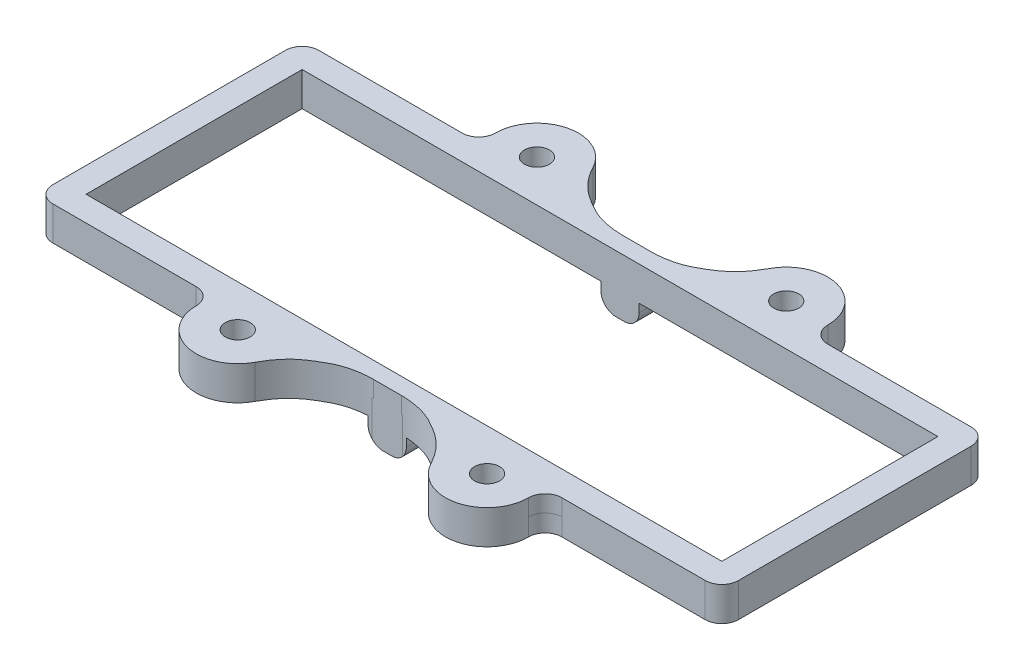
from build123d import *
from build123d.topology import SkipClean

# Parameters (mm, degrees)
SKETCH1_W           = 40
SKETCH1_H           = 7
SKETCH1_R           = 1.5
SKETCH1_W_2         = 82.5
SKETCH1_H_2         = 32
SKETCH1_W_3         = 76.5
SKETCH1_H_3         = 26
BOSS_EXTRUDE1_DEPTH = 2.085
SKETCH2_W           = 5
SKETCH2_H           = 10
BOSS_EXTRUDE2_DEPTH = 3
FILLET1_R           = 2
FILLET2_R           = 2
CUT_EXTRUDE1_DEPTH  = 65.136818612
SKETCH4_W           = 30
SKETCH4_H           = 6.817038716
CUT_EXTRUDE2_DEPTH  = 53.089568977
FILLET3_R           = 5
FILLET4_R           = 2
BOSS_EXTRUDE3_START = 2
SKETCH5_R           = 1.5
BOSS_EXTRUDE3_DEPTH = 2
FILLET5_START       = 2.085
FILLET5_DEPTH       = 2


with BuildPart() as part:
    # Sketch1 → Boss-Extrude1 (new body)
    # profile 1 of 3: a face of its own
    with BuildSketch(Plane(origin=(0, 0, 0), x_dir=(1, 0, 0), z_dir=(0, 1, 0))):
        with Locations((-3.342953498, -16.024946279)):
            Rectangle(SKETCH1_W, SKETCH1_H)
        with Locations(Location((-18.342953498, -14.524946279, 0), (0, 0, 270))):
            Circle(SKETCH1_R, mode=Mode.SUBTRACT)
        with Locations(Location((11.657046502, -14.524946279, 0), (0, 0, 270))):
            Circle(SKETCH1_R, mode=Mode.SUBTRACT)
    # profile 2 of 3: a face of its own
    with BuildSketch(Plane(origin=(0, 0, 0), x_dir=(1, 0, 0), z_dir=(0, 1, 0))):
        with Locations((-3.342953498, 3.475053721)):
            Rectangle(SKETCH1_W_2, SKETCH1_H_2)
        with Locations((-3.342953498, 3.475053721)):
            Rectangle(SKETCH1_W_3, SKETCH1_H_3, mode=Mode.SUBTRACT)
    # profile 3 of 3: a face of its own
    with BuildSketch(Plane(origin=(0, 0, 0), x_dir=(1, 0, 0), z_dir=(0, 1, 0))):
        with Locations((-3.342953498, 22.975053721)):
            Rectangle(SKETCH1_W, SKETCH1_H)
        with Locations(Location((-18.342953498, 21.475053721, 0), (0, 0, 270))):
            Circle(SKETCH1_R, mode=Mode.SUBTRACT)
        with Locations(Location((11.657046502, 21.475053721, 0), (0, 0, 270))):
            Circle(SKETCH1_R, mode=Mode.SUBTRACT)
    extrude(amount=BOSS_EXTRUDE1_DEPTH)

    # Sketch2 → Boss-Extrude2 (add)
    with BuildSketch(Plane.XZ):
        with Locations((-3.342953498, 14.524946279)):
            Rectangle(SKETCH2_W, SKETCH2_H)
        with Locations((-3.342953498, -21.475053721)):
            Rectangle(SKETCH2_W, SKETCH2_H)
    extrude(amount=BOSS_EXTRUDE2_DEPTH)

    # Fillet1
    fillet1_edges = [part.edges().sort_by_distance(p)[0] for p in [
        (-5.842953498, -3, 14.524946279),
        (-0.842953498, -3, 14.524946279),
        (-0.842953498, -3, -21.475053721),
        (-5.842953498, -3, -21.475053721),
    ]]
    fillet(fillet1_edges, radius=FILLET1_R)

    # Fillet2
    fillet2_edges = [part.edges().sort_by_distance(p)[0] for p in [
        (-44.592953498, 1.0425, 12.524946279),
        (-44.592953498, 1.0425, -19.475053721),
        (37.907046502, 1.0425, -19.475053721),
        (37.907046502, 1.0425, 12.524946279),
    ]]
    fillet(fillet2_edges, radius=FILLET2_R)

    # Sketch3 → Cut-Extrude1 (cut, through all)
    with BuildSketch(Plane(origin=(0, 0, -26.475053721), x_dir=(-1, 0, 0), z_dir=(0, 0, -1))):
        with BuildLine():
            Line((5.842953498, -1), (5.842953498, 0))
            Line((5.842953498, 0), (5.642953498, 0))
            Line((5.642953498, 0), (5.642953498, -1))
            ThreePointArc((5.642953498, -1), (5.115745704, -2.272792206), (3.842953498, -2.8))
            Line((3.842953498, -2.8), (2.842953498, -2.8))
            ThreePointArc((2.842953498, -2.8), (1.570161291, -2.272792206), (1.042953498, -1))
            Line((1.042953498, -1), (1.042953498, 0))
            Line((1.042953498, 0), (0.842953498, 0))
            Line((0.842953498, 0), (0.842953498, -1))
            ThreePointArc((0.842953498, -1), (1.428739935, -2.414213562), (2.842953498, -3))
            Line((2.842953498, -3), (3.842953498, -3))
            ThreePointArc((3.842953498, -3), (5.25716706, -2.414213562), (5.842953498, -1))
        make_face()
    extrude(amount=-CUT_EXTRUDE1_DEPTH, mode=Mode.SUBTRACT)

    # Sketch4 → Cut-Extrude2 (cut, through all)
    with BuildSketch(Plane(origin=(0, 2.085, 0), x_dir=(1, 0, 0), z_dir=(0, 1, 0))):
        with BuildLine():
            Line((-5.025587433, 18.475053721), (-3.342953498, 18.475053721))
            Line((-3.342953498, 18.475053721), (-1.660319563, 18.475053721))
            Line((-1.660319563, 18.475053721), (-1.5063675, 18.475053721))
            add(Edge.make_bspline(
                [(7.234880115, 23.808387054), (6.697838422, 22.80689338), (5.54618786, 21.222701251), (3.456402004, 19.887657692), (1.890908212, 19.048171258), (0.265447838, 18.611656881), (-0.841891354, 18.480685845), (-1.5063675, 18.475053721)],
                knots=[0, 0, 0, 0, 0.31493804, 0.524439854, 0.679221784, 0.802825172, 0.985869019, 0.985869019, 0.985869019, 0.985869019], degree=3))
            ThreePointArc((7.234880115, 23.808387054), (9.075057605, 25.756797914), (11.657046502, 26.475053721))
            Line((11.657046502, 26.475053721), (-18.342953498, 26.475053721))
            ThreePointArc((-18.342953498, 26.475053721), (-15.7609646, 25.756797914), (-13.92078711, 23.808387054))
            add(Edge.make_bspline(
                [(-13.92078711, 23.808387054), (-13.383745417, 22.80689338), (-12.232094855, 21.222701251), (-10.142308999, 19.887657692), (-8.576815207, 19.048171258), (-6.951354833, 18.611656881), (-5.844015641, 18.480685845), (-5.179539495, 18.475053721)],
                knots=[0, 0, 0, 0, 0.31493804, 0.524439854, 0.679221784, 0.802825172, 0.985869019, 0.985869019, 0.985869019, 0.985869019], degree=3))
            Line((-5.179539495, 18.475053721), (-5.025587433, 18.475053721))
        make_face()
        with Locations((-3.342953498, 29.883573079)):
            Rectangle(SKETCH4_W, SKETCH4_H)
        with BuildLine():
            ThreePointArc((-13.92078711, -16.858279612), (-15.7609646, -18.806690472), (-18.342953498, -19.524946279))
            Line((-18.342953498, -19.524946279), (11.657046502, -19.524946279))
            ThreePointArc((11.657046502, -19.524946279), (9.075057605, -18.806690472), (7.234880115, -16.858279612))
            add(Edge.make_bspline(
                [(7.234880115, -16.858279612), (6.697838422, -15.856785937), (5.54618786, -14.272593809), (3.456402004, -12.937550249), (1.890908212, -12.098063816), (0.265447838, -11.661549439), (-0.841891354, -11.530578403), (-1.5063675, -11.524946279)],
                knots=[0, 0, 0, 0, 0.31493804, 0.524439854, 0.679221784, 0.802825172, 0.985869019, 0.985869019, 0.985869019, 0.985869019], degree=3))
            Line((-1.5063675, -11.524946279), (-1.660319563, -11.524946279))
            Line((-1.660319563, -11.524946279), (-3.342953498, -11.524946279))
            Line((-3.342953498, -11.524946279), (-5.025587433, -11.524946279))
            Line((-5.025587433, -11.524946279), (-5.179539495, -11.524946279))
            add(Edge.make_bspline(
                [(-13.92078711, -16.858279612), (-13.383745417, -15.856785937), (-12.232094855, -14.272593809), (-10.142308999, -12.937550249), (-8.576815207, -12.098063816), (-6.951354833, -11.661549439), (-5.844015641, -11.530578403), (-5.179539495, -11.524946279)],
                knots=[0, 0, 0, 0, 0.31493804, 0.524439854, 0.679221784, 0.802825172, 0.985869019, 0.985869019, 0.985869019, 0.985869019], degree=3))
        make_face()
        with Locations((-3.342953498, -22.933465637)):
            Rectangle(SKETCH4_W, SKETCH4_H)
    extrude(amount=-CUT_EXTRUDE2_DEPTH, mode=Mode.SUBTRACT)

    # Fillet3
    fillet3_edges = [part.edges().sort_by_distance(p)[0] for p in [
        (16.657046502, 1.0425, -26.475053721),
        (-23.342953498, 1.0425, -26.475053721),
        (-23.342953498, 1.0425, 19.524946279),
        (16.657046502, 1.0425, 19.524946279),
    ]]
    fillet(fillet3_edges, radius=FILLET3_R - 0.0001)  # a hair under: the kernel refuses the full size

    # Fillet4
    fillet4_edges = [part.edges().sort_by_distance(p)[0] for p in [
        (-23.342953498, 1.0425, 12.524946279),
        (-23.342953498, 1.0425, -19.475053721),
        (16.657046502, 1.0425, -19.475053721),
        (16.657046502, 1.0425, 12.524946279),
    ]]
    fillet(fillet4_edges, radius=FILLET4_R)

    # Sketch5 → Boss-Extrude3 (add)
    # profile 1 of 26: a face of its own
    with SkipClean():  # the faces are left unmerged after this step: merging them gives an invalid solid
        with BuildSketch(Plane(origin=(0, 2.085, 0), x_dir=(1, 0, 0), z_dir=(0, 1, 0)).offset(BOSS_EXTRUDE3_START)):
            with BuildLine():
                ThreePointArc((-18.343003498, 26.475053721), (-21.878490939, 25.010584091), (-23.342953497, 21.475093721))
                ThreePointArc((-23.342953497, 21.475093721), (-23.237489148, 20.453525081), (-22.925529193, 19.475053721))
                Line((-22.925529193, 19.475053721), (-14.342953498, 19.475053721))
                Line((-14.342953498, 19.475053721), (-14.342953498, 24.475053721))
                ThreePointArc((-14.342953498, 24.475053721), (-16.106907881, 25.947200856), (-18.343003498, 26.475053721))
            make_face()
            with Locations((-18.342953498, 21.475053721)):
                Circle(SKETCH5_R, mode=Mode.SUBTRACT)
        # profile 2 of 26: a face of its own
        with BuildSketch(Plane(origin=(0, 2.085, 0), x_dir=(1, 0, 0), z_dir=(0, 1, 0)).offset(BOSS_EXTRUDE3_START)):
            with BuildLine():
                Line((-22.925529193, 19.475053721), (-23.342953498, 19.475053721))
                Line((-23.342953498, 19.475053721), (-23.342953498, 16.475053721))
                Line((-23.342953498, 16.475053721), (-18.342953499, 16.475053721))
                ThreePointArc((-18.342953499, 16.475053721), (-21.081566286, 17.291753589), (-22.925529193, 19.475053721))
            make_face()
        # profile 3 of 26: a face of its own
        with BuildSketch(Plane(origin=(0, 2.085, 0), x_dir=(1, 0, 0), z_dir=(0, 1, 0)).offset(BOSS_EXTRUDE3_START)):
            with BuildLine():
                Line((-23.342953498, 16.475053721), (-23.342953498, 19.475053721))
                Line((-23.342953498, 19.475053721), (-25.342953498, 19.475053721))
                Line((-25.342953498, 19.475053721), (-42.592953498, 19.475053721))
                ThreePointArc((-42.592953498, 19.475053721), (-44.00716706, 18.889267283), (-44.592953498, 17.475053721))
                Line((-44.592953498, 17.475053721), (-44.592953498, -10.524946279))
                ThreePointArc((-44.592953498, -10.524946279), (-44.00716706, -11.939159841), (-42.592953498, -12.524946279))
                Line((-42.592953498, -12.524946279), (-25.342953498, -12.524946279))
                Line((-25.342953498, -12.524946279), (-23.342953498, -12.524946279))
                Line((-23.342953498, -12.524946279), (-23.342953498, -9.524946279))
                Line((-23.342953498, -9.524946279), (-41.592953498, -9.524946279))
                Line((-41.592953498, -9.524946279), (-41.592953498, 16.475053721))
                Line((-41.592953498, 16.475053721), (-23.342953498, 16.475053721))
            make_face()
        # profile 4 of 26: a face of its own
        with BuildSketch(Plane(origin=(0, 2.085, 0), x_dir=(1, 0, 0), z_dir=(0, 1, 0)).offset(BOSS_EXTRUDE3_START)):
            with BuildLine():
                Line((-14.342953498, 19.475053721), (-22.925529193, 19.475053721))
                ThreePointArc((-22.925529193, 19.475053721), (-21.081566286, 17.291753589), (-18.342953499, 16.475053721))
                ThreePointArc((-18.342953499, 16.475053721), (-16.106885521, 17.002917766), (-14.342953498, 18.475053721))
                Line((-14.342953498, 18.475053721), (-14.342953498, 19.475053721))
            make_face()
        # profile 5 of 26: a face of its own
        with BuildSketch(Plane(origin=(0, 2.085, 0), x_dir=(1, 0, 0), z_dir=(0, 1, 0)).offset(BOSS_EXTRUDE3_START)):
            with BuildLine():
                ThreePointArc((-13.92078711, 23.808387054), (-14.118698205, 24.150061614), (-14.342953498, 24.475053721))
                Line((-14.342953498, 24.475053721), (-14.342953498, 19.475053721))
                Line((-14.342953498, 19.475053721), (-13.760377803, 19.475053721))
                ThreePointArc((-13.760377803, 19.475053721), (-13.448421933, 20.453505503), (-13.342953498, 21.475053721))
                ThreePointArc((-13.342953498, 21.475053721), (-13.489561285, 22.676962217), (-13.92078711, 23.808387054))
            make_face()
        # profile 6 of 26: a face of its own
        with BuildSketch(Plane(origin=(0, 2.085, 0), x_dir=(1, 0, 0), z_dir=(0, 1, 0)).offset(BOSS_EXTRUDE3_START)):
            with BuildLine():
                Line((-13.760377803, 19.475053721), (-14.342953498, 19.475053721))
                Line((-14.342953498, 19.475053721), (-14.342953498, 18.475053721))
                ThreePointArc((-14.342953498, 18.475053721), (-14.022635061, 18.958141206), (-13.760377803, 19.475053721))
            make_face()
        # profile 7 of 26: a face of its own
        with BuildSketch(Plane(origin=(0, 2.085, 0), x_dir=(1, 0, 0), z_dir=(0, 1, 0)).offset(BOSS_EXTRUDE3_START)):
            with BuildLine():
                ThreePointArc((-14.342953498, 18.475053721), (-16.106885521, 17.002917766), (-18.342953499, 16.475053721))
                Line((-18.342953499, 16.475053721), (11.657046523, 16.475053721))
                ThreePointArc((11.657046523, 16.475053721), (9.420978534, 17.002917762), (7.657046502, 18.475053721))
                Line((7.657046502, 18.475053721), (-1.5063675, 18.475053721))
                add(Edge.make_bspline(
                    [(-1.5063675, 18.475053721), (-1.557665042, 18.474618921), (-1.608983344, 18.47461649), (-1.660319563, 18.475053721)],
                    knots=[0.985869019, 0.985869019, 0.985869019, 0.985869019, 1, 1, 1, 1], degree=3))
                Line((-1.660319563, 18.475053721), (-3.342953498, 18.475053721))
                Line((-3.342953498, 18.475053721), (-5.025587433, 18.475053721))
                add(Edge.make_bspline(
                    [(-5.179539495, 18.475053721), (-5.128241953, 18.474618921), (-5.076923651, 18.47461649), (-5.025587433, 18.475053721)],
                    knots=[0.985869019, 0.985869019, 0.985869019, 0.985869019, 1, 1, 1, 1], degree=3))
                Line((-5.179539495, 18.475053721), (-14.342953498, 18.475053721))
            make_face()
        # profile 8 of 26: a face of its own
        with BuildSketch(Plane(origin=(0, 2.085, 0), x_dir=(1, 0, 0), z_dir=(0, 1, 0)).offset(BOSS_EXTRUDE3_START)):
            with BuildLine():
                add(Edge.make_bspline(
                    [(-13.92078711, 23.808387054), (-13.383745417, 22.80689338), (-12.232094855, 21.222701251), (-10.424029044, 20.067632367), (-9.557996846, 19.581589064), (-9.354549961, 19.475053721)],
                    knots=[0, 0, 0, 0, 0.31493804, 0.524439854, 0.587657191, 0.587657191, 0.587657191, 0.587657191], degree=3))
                ThreePointArc((-13.92078711, 23.808387054), (-13.489561285, 22.676962217), (-13.342953498, 21.475053721))
                ThreePointArc((-13.342953498, 21.475053721), (-13.448421933, 20.453505503), (-13.760377803, 19.475053721))
                Line((-13.760377803, 19.475053721), (-9.354549961, 19.475053721))
            make_face()
        # profile 9 of 26: a face of its own
        with BuildSketch(Plane(origin=(0, 2.085, 0), x_dir=(1, 0, 0), z_dir=(0, 1, 0)).offset(BOSS_EXTRUDE3_START)):
            with BuildLine():
                ThreePointArc((-13.760377803, 19.475053721), (-14.022635061, 18.958141206), (-14.342953498, 18.475053721))
                Line((-14.342953498, 18.475053721), (-5.179539495, 18.475053721))
                add(Edge.make_bspline(
                    [(-9.354549961, 19.475053721), (-9.059875559, 19.320746917), (-8.354121704, 18.98836733), (-6.951354833, 18.611656881), (-5.844015641, 18.480685845), (-5.179539495, 18.475053721)],
                    knots=[0.587657191, 0.587657191, 0.587657191, 0.587657191, 0.679221784, 0.802825172, 0.985869019, 0.985869019, 0.985869019, 0.985869019], degree=3))
                Line((-9.354549961, 19.475053721), (-13.760377803, 19.475053721))
            make_face()
        # profile 10 of 26: a face of its own
        with BuildSketch(Plane(origin=(0, 2.085, 0), x_dir=(1, 0, 0), z_dir=(0, 1, 0)).offset(BOSS_EXTRUDE3_START)):
            with BuildLine():
                ThreePointArc((16.239622197, 19.475053721), (14.395659298, 17.291753594), (11.657046523, 16.475053721))
                Line((11.657046523, 16.475053721), (16.657046502, 16.475053721))
                Line((16.657046502, 16.475053721), (16.657046502, 19.475053721))
                Line((16.657046502, 19.475053721), (16.239622197, 19.475053721))
            make_face()
        # profile 11 of 26: a face of its own
        with BuildSketch(Plane(origin=(0, 2.085, 0), x_dir=(1, 0, 0), z_dir=(0, 1, 0)).offset(BOSS_EXTRUDE3_START)):
            with BuildLine():
                ThreePointArc((7.657046502, 18.475053721), (9.420978534, 17.002917762), (11.657046523, 16.475053721))
                ThreePointArc((11.657046523, 16.475053721), (14.395659298, 17.291753594), (16.239622197, 19.475053721))
                Line((16.239622197, 19.475053721), (7.074470807, 19.475053721))
                ThreePointArc((7.074470807, 19.475053721), (7.336728066, 18.958141206), (7.657046502, 18.475053721))
            make_face()
        # profile 12 of 26: a face of its own
        with BuildSketch(Plane(origin=(0, 2.085, 0), x_dir=(1, 0, 0), z_dir=(0, 1, 0)).offset(BOSS_EXTRUDE3_START)):
            with BuildLine():
                Line((16.657046502, 19.475053721), (16.657046502, 16.475053721))
                Line((16.657046502, 16.475053721), (34.907046502, 16.475053721))
                Line((34.907046502, 16.475053721), (34.907046502, -9.524946279))
                Line((34.907046502, -9.524946279), (16.657046502, -9.524946279))
                Line((16.657046502, -9.524946279), (16.657046502, -12.524946279))
                Line((16.657046502, -12.524946279), (18.657046502, -12.524946279))
                Line((18.657046502, -12.524946279), (35.907046502, -12.524946279))
                ThreePointArc((35.907046502, -12.524946279), (37.321260065, -11.939159841), (37.907046502, -10.524946279))
                Line((37.907046502, -10.524946279), (37.907046502, 17.475053721))
                ThreePointArc((37.907046502, 17.475053721), (37.321260065, 18.889267283), (35.907046502, 19.475053721))
                Line((35.907046502, 19.475053721), (18.657046502, 19.475053721))
                Line((18.657046502, 19.475053721), (16.657046502, 19.475053721))
            make_face()
        # profile 13 of 26: a face of its own
        with BuildSketch(Plane(origin=(0, 2.085, 0), x_dir=(1, 0, 0), z_dir=(0, 1, 0)).offset(BOSS_EXTRUDE3_START)):
            with BuildLine():
                Line((-1.5063675, 18.475053721), (7.657046502, 18.475053721))
                ThreePointArc((7.657046502, 18.475053721), (7.336728066, 18.958141206), (7.074470807, 19.475053721))
                Line((7.074470807, 19.475053721), (2.668642966, 19.475053721))
                add(Edge.make_bspline(
                    [(2.668642966, 19.475053721), (2.373968563, 19.320746917), (1.668214709, 18.98836733), (0.265447838, 18.611656881), (-0.841891354, 18.480685845), (-1.5063675, 18.475053721)],
                    knots=[0.587657191, 0.587657191, 0.587657191, 0.587657191, 0.679221784, 0.802825172, 0.985869019, 0.985869019, 0.985869019, 0.985869019], degree=3))
            make_face()
        # profile 14 of 26: a face of its own
        with BuildSketch(Plane(origin=(0, 2.085, 0), x_dir=(1, 0, 0), z_dir=(0, 1, 0)).offset(BOSS_EXTRUDE3_START)):
            with BuildLine():
                Line((7.074470807, 19.475053721), (16.239622197, 19.475053721))
                ThreePointArc((16.239622197, 19.475053721), (16.551578067, 20.453505503), (16.657046502, 21.475053721))
                ThreePointArc((16.657046502, 21.475053721), (15.192598086, 25.010569949), (11.657096502, 26.475053721))
                ThreePointArc((11.657096502, 26.475053721), (9.075079014, 25.756810824), (7.234880115, 23.808387054))
                ThreePointArc((7.234880115, 23.808387054), (6.66046873, 21.660014702), (7.074470807, 19.475053721))
            make_face()
            with Locations((11.657046502, 21.475053721)):
                Circle(SKETCH5_R, mode=Mode.SUBTRACT)
        # profile 15 of 26: a face of its own
        with BuildSketch(Plane(origin=(0, 2.085, 0), x_dir=(1, 0, 0), z_dir=(0, 1, 0)).offset(BOSS_EXTRUDE3_START)):
            with BuildLine():
                Line((-18.342953493, -9.524946279), (-23.342953498, -9.524946279))
                Line((-23.342953498, -9.524946279), (-23.342953498, -12.524946279))
                Line((-23.342953498, -12.524946279), (-22.925529193, -12.524946279))
                ThreePointArc((-22.925529193, -12.524946279), (-21.081566283, -10.341646145), (-18.342953493, -9.524946279))
            make_face()
        # profile 16 of 26: a face of its own
        with BuildSketch(Plane(origin=(0, 2.085, 0), x_dir=(1, 0, 0), z_dir=(0, 1, 0)).offset(BOSS_EXTRUDE3_START)):
            with BuildLine():
                add(Edge.make_bspline(
                    [(7.234880115, 23.808387054), (6.697838422, 22.80689338), (5.54618786, 21.222701251), (3.738122049, 20.067632367), (2.872089851, 19.581589064), (2.668642966, 19.475053721)],
                    knots=[0, 0, 0, 0, 0.31493804, 0.524439854, 0.587657191, 0.587657191, 0.587657191, 0.587657191], degree=3))
                Line((2.668642966, 19.475053721), (7.074470807, 19.475053721))
                ThreePointArc((7.074470807, 19.475053721), (6.66046873, 21.660014702), (7.234880115, 23.808387054))
            make_face()
        # profile 17 of 26: a face of its own
        with BuildSketch(Plane(origin=(0, 2.085, 0), x_dir=(1, 0, 0), z_dir=(0, 1, 0)).offset(BOSS_EXTRUDE3_START)):
            with BuildLine():
                Line((11.657046502, -9.524946279), (-18.342953493, -9.524946279))
                ThreePointArc((-18.342953493, -9.524946279), (-16.106885518, -10.052810325), (-14.342953498, -11.524946279))
                Line((-14.342953498, -11.524946279), (-5.179539495, -11.524946279))
                add(Edge.make_bspline(
                    [(-5.179539495, -11.524946279), (-5.128241953, -11.524511479), (-5.076923651, -11.524509048), (-5.025587433, -11.524946279)],
                    knots=[0.985869019, 0.985869019, 0.985869019, 0.985869019, 1, 1, 1, 1], degree=3))
                Line((-5.025587433, -11.524946279), (-3.342953498, -11.524946279))
                Line((-3.342953498, -11.524946279), (-1.660319563, -11.524946279))
                add(Edge.make_bspline(
                    [(-1.5063675, -11.524946279), (-1.557665042, -11.524511479), (-1.608983344, -11.524509048), (-1.660319563, -11.524946279)],
                    knots=[0.985869019, 0.985869019, 0.985869019, 0.985869019, 1, 1, 1, 1], degree=3))
                Line((-1.5063675, -11.524946279), (7.657046502, -11.524946279))
                ThreePointArc((7.657046502, -11.524946279), (9.420978525, -10.052810324), (11.657046502, -9.524946279))
            make_face()
        # profile 18 of 26: a face of its own
        with BuildSketch(Plane(origin=(0, 2.085, 0), x_dir=(1, 0, 0), z_dir=(0, 1, 0)).offset(BOSS_EXTRUDE3_START)):
            with BuildLine():
                ThreePointArc((-14.342953498, -11.524946279), (-16.106885518, -10.052810325), (-18.342953493, -9.524946279))
                ThreePointArc((-18.342953493, -9.524946279), (-21.081566283, -10.341646145), (-22.925529193, -12.524946279))
                Line((-22.925529193, -12.524946279), (-13.760377803, -12.524946279))
                ThreePointArc((-13.760377803, -12.524946279), (-14.022635061, -12.008033764), (-14.342953498, -11.524946279))
            make_face()
        # profile 19 of 26: a face of its own
        with BuildSketch(Plane(origin=(0, 2.085, 0), x_dir=(1, 0, 0), z_dir=(0, 1, 0)).offset(BOSS_EXTRUDE3_START)):
            with BuildLine():
                Line((16.657046502, -9.524946279), (11.657046502, -9.524946279))
                ThreePointArc((11.657046502, -9.524946279), (14.39565929, -10.341646146), (16.239622197, -12.524946279))
                Line((16.239622197, -12.524946279), (16.657046502, -12.524946279))
                Line((16.657046502, -12.524946279), (16.657046502, -9.524946279))
            make_face()
        # profile 20 of 26: a face of its own
        with BuildSketch(Plane(origin=(0, 2.085, 0), x_dir=(1, 0, 0), z_dir=(0, 1, 0)).offset(BOSS_EXTRUDE3_START)):
            with BuildLine():
                ThreePointArc((16.239622197, -12.524946279), (14.39565929, -10.341646146), (11.657046502, -9.524946279))
                ThreePointArc((11.657046502, -9.524946279), (9.420978525, -10.052810324), (7.657046502, -11.524946279))
                ThreePointArc((7.657046502, -11.524946279), (7.336728066, -12.008033764), (7.074470807, -12.524946279))
                Line((7.074470807, -12.524946279), (16.239622197, -12.524946279))
            make_face()
        # profile 21 of 26: a face of its own
        with BuildSketch(Plane(origin=(0, 2.085, 0), x_dir=(1, 0, 0), z_dir=(0, 1, 0)).offset(BOSS_EXTRUDE3_START)):
            with BuildLine():
                Line((-5.179539495, -11.524946279), (-14.342953498, -11.524946279))
                ThreePointArc((-14.342953498, -11.524946279), (-14.022635061, -12.008033764), (-13.760377803, -12.524946279))
                Line((-13.760377803, -12.524946279), (-9.354549961, -12.524946279))
                add(Edge.make_bspline(
                    [(-9.354549961, -12.524946279), (-9.059875559, -12.370639475), (-8.354121704, -12.038259888), (-6.951354833, -11.661549439), (-5.844015641, -11.530578403), (-5.179539495, -11.524946279)],
                    knots=[0.587657191, 0.587657191, 0.587657191, 0.587657191, 0.679221784, 0.802825172, 0.985869019, 0.985869019, 0.985869019, 0.985869019], degree=3))
            make_face()
        # profile 22 of 26: a face of its own
        with BuildSketch(Plane(origin=(0, 2.085, 0), x_dir=(1, 0, 0), z_dir=(0, 1, 0)).offset(BOSS_EXTRUDE3_START)):
            with BuildLine():
                Line((-13.760377803, -12.524946279), (-22.925529193, -12.524946279))
                ThreePointArc((-22.925529193, -12.524946279), (-23.237489148, -13.503417639), (-23.342953497, -14.524986279))
                ThreePointArc((-23.342953497, -14.524986279), (-21.878490939, -18.060476649), (-18.343003498, -19.524946279))
                ThreePointArc((-18.343003498, -19.524946279), (-15.760986009, -18.806703382), (-13.92078711, -16.858279612))
                ThreePointArc((-13.92078711, -16.858279612), (-13.489561285, -15.726854775), (-13.342953498, -14.524946279))
                ThreePointArc((-13.342953498, -14.524946279), (-13.448421933, -13.50339806), (-13.760377803, -12.524946279))
            make_face()
            with Locations((-18.342953498, -14.524946279)):
                Circle(SKETCH5_R, mode=Mode.SUBTRACT)
        # profile 23 of 26: a face of its own
        with BuildSketch(Plane(origin=(0, 2.085, 0), x_dir=(1, 0, 0), z_dir=(0, 1, 0)).offset(BOSS_EXTRUDE3_START)):
            with BuildLine():
                ThreePointArc((16.657046502, -14.524946279), (16.551578067, -13.50339806), (16.239622197, -12.524946279))
                Line((16.239622197, -12.524946279), (7.074470807, -12.524946279))
                ThreePointArc((7.074470807, -12.524946279), (6.66046873, -14.709907259), (7.234880115, -16.858279612))
                ThreePointArc((7.234880115, -16.858279612), (9.075079014, -18.806703382), (11.657096502, -19.524946279))
                ThreePointArc((11.657096502, -19.524946279), (15.192598086, -18.060462507), (16.657046502, -14.524946279))
            make_face()
            with Locations((11.657046502, -14.524946279)):
                Circle(SKETCH5_R, mode=Mode.SUBTRACT)
        # profile 24 of 26: a face of its own
        with BuildSketch(Plane(origin=(0, 2.085, 0), x_dir=(1, 0, 0), z_dir=(0, 1, 0)).offset(BOSS_EXTRUDE3_START)):
            with BuildLine():
                ThreePointArc((7.074470807, -12.524946279), (7.336728066, -12.008033764), (7.657046502, -11.524946279))
                Line((7.657046502, -11.524946279), (-1.5063675, -11.524946279))
                add(Edge.make_bspline(
                    [(2.668642966, -12.524946279), (2.373968563, -12.370639475), (1.668214709, -12.038259888), (0.265447838, -11.661549439), (-0.841891354, -11.530578403), (-1.5063675, -11.524946279)],
                    knots=[0.587657191, 0.587657191, 0.587657191, 0.587657191, 0.679221784, 0.802825172, 0.985869019, 0.985869019, 0.985869019, 0.985869019], degree=3))
                Line((2.668642966, -12.524946279), (7.074470807, -12.524946279))
            make_face()
        # profile 25 of 26: a face of its own
        with BuildSketch(Plane(origin=(0, 2.085, 0), x_dir=(1, 0, 0), z_dir=(0, 1, 0)).offset(BOSS_EXTRUDE3_START)):
            with BuildLine():
                Line((-9.354549961, -12.524946279), (-13.760377803, -12.524946279))
                ThreePointArc((-13.760377803, -12.524946279), (-13.448421933, -13.50339806), (-13.342953498, -14.524946279))
                ThreePointArc((-13.342953498, -14.524946279), (-13.489561285, -15.726854775), (-13.92078711, -16.858279612))
                add(Edge.make_bspline(
                    [(-13.92078711, -16.858279612), (-13.383745417, -15.856785937), (-12.232094855, -14.272593809), (-10.424029044, -13.117524925), (-9.557996846, -12.631481622), (-9.354549961, -12.524946279)],
                    knots=[0, 0, 0, 0, 0.31493804, 0.524439854, 0.587657191, 0.587657191, 0.587657191, 0.587657191], degree=3))
            make_face()
        # profile 26 of 26: a face of its own
        with BuildSketch(Plane(origin=(0, 2.085, 0), x_dir=(1, 0, 0), z_dir=(0, 1, 0)).offset(BOSS_EXTRUDE3_START)):
            with BuildLine():
                ThreePointArc((7.234880115, -16.858279612), (6.66046873, -14.709907259), (7.074470807, -12.524946279))
                Line((7.074470807, -12.524946279), (2.668642966, -12.524946279))
                add(Edge.make_bspline(
                    [(7.234880115, -16.858279612), (6.697838422, -15.856785937), (5.54618786, -14.272593809), (3.738122049, -13.117524925), (2.872089851, -12.631481622), (2.668642966, -12.524946279)],
                    knots=[0, 0, 0, 0, 0.31493804, 0.524439854, 0.587657191, 0.587657191, 0.587657191, 0.587657191], degree=3))
            make_face()
        extrude(amount=-BOSS_EXTRUDE3_DEPTH)
    add(part.part.scale(1), mode=Mode.REPLACE)  # the faces are merged on a copy

    # Fillet5: read off the stored shape, not the designer's step
    # Fillet5 outline → Fillet5 (add)
    with SkipClean():  # the faces are left unmerged after this step: merging them gives an invalid solid
        with BuildSketch(Plane(origin=(0, 0, 0), x_dir=(1, 0, 0), z_dir=(0, 1, 0)).offset(FILLET5_START)):
            with BuildLine():
                ThreePointArc((16.657046502, -14.524946279), (17.24283294, -13.110732717), (18.657046502, -12.524946279))
                Line((18.657046502, -12.524946279), (16.239622197, -12.524946279))
                ThreePointArc((16.239622197, -12.524946279), (16.551578067, -13.503398061), (16.657046502, -14.524946279))
            make_face()
            with BuildLine():
                ThreePointArc((-25.342953498, -12.524946279), (-23.928739935, -13.110732716), (-23.342953498, -14.524946279))
                ThreePointArc((-23.342953498, -14.524946279), (-23.237485063, -13.503398061), (-22.925529193, -12.524946279))
                Line((-22.925529193, -12.524946279), (-25.342953498, -12.524946279))
            make_face()
            with BuildLine():
                ThreePointArc((-23.342953498, 21.475053721), (-23.928739936, 20.060840158), (-25.342953498, 19.475053721))
                Line((-25.342953498, 19.475053721), (-22.925529193, 19.475053721))
                ThreePointArc((-22.925529193, 19.475053721), (-23.237485063, 20.453505503), (-23.342953498, 21.475053721))
            make_face()
            with BuildLine():
                ThreePointArc((18.657046502, 19.475053721), (17.24283294, 20.060840159), (16.657046502, 21.475053721))
                ThreePointArc((16.657046502, 21.475053721), (16.551578067, 20.453505503), (16.239622197, 19.475053721))
                Line((16.239622197, 19.475053721), (18.657046502, 19.475053721))
            make_face()
        extrude(amount=FILLET5_DEPTH)


solid = part.part
